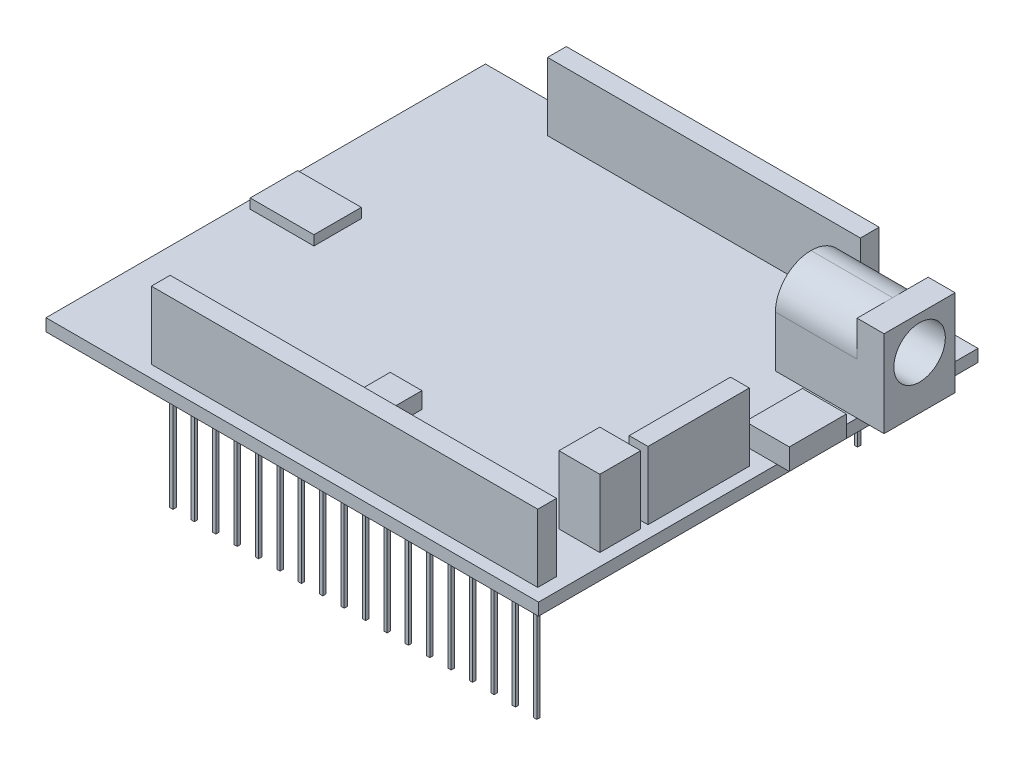
from build123d import *

# Parameters (mm, degrees)
SKETCH1_W            = 60.3
SKETCH1_H            = 53.8
BOSS_EXTRUDE1_DEPTH  = 1.5
SKETCH2_W            = 38.3
SKETCH2_H            = 2.3
SKETCH2_W_2          = 47.3
BOSS_EXTRUDE2_DEPTH  = 8.3
SKETCH3_W            = 5
SKETCH3_H            = 5
BOSS_EXTRUDE3_DEPTH  = 8.3
SKETCH4_W            = 2.3
SKETCH4_H            = 12.4
BOSS_EXTRUDE4_DEPTH  = 8.3
SKETCH5_W            = 5.4
SKETCH5_H            = 7
BOSS_EXTRUDE5_DEPTH  = 2.6
SKETCH6_W            = 7.8
SKETCH6_H            = 5.8
BOSS_EXTRUDE6_DEPTH  = 1.2
SKETCH7_W            = 10
SKETCH7_H            = 8.7
BOSS_EXTRUDE7_DEPTH  = 10.6
FILLET1_R            = 4.35
SKETCH9_W            = 3.3
SKETCH9_H            = 8.7
BOSS_EXTRUDE8_DEPTH  = 10.6
SKETCH10_R           = 3.15
CUT_EXTRUDE1_DEPTH   = 10.6
SKETCH11_W           = 0.4
SKETCH11_H           = 0.4
BOSS_EXTRUDE9_DEPTH  = 23.3
SKETCH12_W           = 0.4
SKETCH12_H           = 0.4
BOSS_EXTRUDE10_DEPTH = 23.3
SKETCH13_W           = 3.88
SKETCH13_H           = 5.16
BOSS_EXTRUDE11_DEPTH = 2


with BuildPart() as part:
    # Sketch1 → Boss-Extrude1 (new body)
    with BuildSketch(Plane(origin=(0, 0, 0), x_dir=(1, 0, 0), z_dir=(0, 1, 0))):
        Rectangle(SKETCH1_W, SKETCH1_H)
    extrude(amount=BOSS_EXTRUDE1_DEPTH)

    # Sketch2 → Boss-Extrude2 (add)
    with BuildSketch(Plane(origin=(0, 1.5, 0), x_dir=(1, 0, 0), z_dir=(0, 1, 0))):
        with Locations((0.4, 24.25)):
            Rectangle(SKETCH2_W, SKETCH2_H)
        with Locations((4.9, -24.25)):
            Rectangle(SKETCH2_W_2, SKETCH2_H)
    extrude(amount=BOSS_EXTRUDE2_DEPTH)

    # Sketch3 → Boss-Extrude3 (add)
    with BuildSketch(Plane(origin=(0, 1.5, 0), x_dir=(1, 0, 0), z_dir=(0, 1, 0))):
        with Locations((26.15, -15.4)):
            Rectangle(SKETCH3_W, SKETCH3_H)
    extrude(amount=BOSS_EXTRUDE3_DEPTH)

    # Sketch4 → Boss-Extrude4 (add)
    with BuildSketch(Plane(origin=(0, 1.5, 0), x_dir=(1, 0, 0), z_dir=(0, 1, 0))):
        with Locations((27.5, -5.8)):
            Rectangle(SKETCH4_W, SKETCH4_H)
    extrude(amount=BOSS_EXTRUDE4_DEPTH)

    # Sketch5 → Boss-Extrude5 (add)
    with BuildSketch(Plane(origin=(0, 1.5, 0), x_dir=(1, 0, 0), z_dir=(0, 1, 0))):
        with Locations((28.95, 5.8)):
            Rectangle(SKETCH5_W, SKETCH5_H)
    extrude(amount=BOSS_EXTRUDE5_DEPTH)

    # Sketch6 → Boss-Extrude6 (add)
    with BuildSketch(Plane(origin=(0, 1.5, 0), x_dir=(1, 0, 0), z_dir=(0, 1, 0))):
        with Locations((-25.25, 0)):
            Rectangle(SKETCH6_W, SKETCH6_H)
    extrude(amount=BOSS_EXTRUDE6_DEPTH)

    # Sketch7 → Boss-Extrude7 (add)
    with BuildSketch(Plane(origin=(0, 1.5, 0), x_dir=(1, 0, 0), z_dir=(0, 1, 0))):
        with Locations((25.15, 16.45)):
            Rectangle(SKETCH7_W, SKETCH7_H)
    extrude(amount=BOSS_EXTRUDE7_DEPTH)

    # Fillet1
    fillet1_edges = [part.edges().sort_by_distance(p)[0] for p in [
        (25.15, 12.1, -20.8),
        (25.15, 12.1, -12.1),
    ]]
    fillet(fillet1_edges, radius=FILLET1_R - 0.0001)  # a hair under: the kernel refuses the full size

    # Sketch9 → Boss-Extrude8 (add)
    with BuildSketch(Plane(origin=(0, 1.5, 0), x_dir=(1, 0, 0), z_dir=(0, 1, 0))):
        with Locations((31.8, 16.45)):
            Rectangle(SKETCH9_W, SKETCH9_H)
    extrude(amount=BOSS_EXTRUDE8_DEPTH)

    # Sketch10 → Cut-Extrude1 (cut)
    with BuildSketch(Plane(origin=(33.45, 0, 0), x_dir=(0, 0, -1), z_dir=(1, 0, 0))):
        with Locations((16.45, 7.95)):
            Circle(SKETCH10_R)
    extrude(amount=-CUT_EXTRUDE1_DEPTH, mode=Mode.SUBTRACT)

    # Sketch11 → Boss-Extrude9 (add)
    with BuildSketch(Plane(origin=(0, 9.8, 0), x_dir=(1, 0, 0), z_dir=(0, 1, 0))):
        with Locations((-17.25, 24.25)):
            Rectangle(SKETCH11_W, SKETCH11_H)
        with Locations((-14.53462, 24.25)):
            Rectangle(SKETCH11_W, SKETCH11_H)
        with Locations((-11.81924, 24.25)):
            Rectangle(SKETCH11_W, SKETCH11_H)
        with Locations((-9.10386, 24.25)):
            Rectangle(SKETCH11_W, SKETCH11_H)
        with Locations((-6.38848, 24.25)):
            Rectangle(SKETCH11_W, SKETCH11_H)
        with Locations((-3.6731, 24.25)):
            Rectangle(SKETCH11_W, SKETCH11_H)
        with Locations((-0.95772, 24.25)):
            Rectangle(SKETCH11_W, SKETCH11_H)
        with Locations((1.75766, 24.25)):
            Rectangle(SKETCH11_W, SKETCH11_H)
        with Locations((4.47304, 24.25)):
            Rectangle(SKETCH11_W, SKETCH11_H)
        with Locations((7.18842, 24.25)):
            Rectangle(SKETCH11_W, SKETCH11_H)
        with Locations((9.9038, 24.25)):
            Rectangle(SKETCH11_W, SKETCH11_H)
        with Locations((12.61918, 24.25)):
            Rectangle(SKETCH11_W, SKETCH11_H)
        with Locations((15.33456, 24.25)):
            Rectangle(SKETCH11_W, SKETCH11_H)
        with Locations((18.04994, 24.25)):
            Rectangle(SKETCH11_W, SKETCH11_H)
    extrude(amount=-BOSS_EXTRUDE9_DEPTH)

    # Sketch12 → Boss-Extrude10 (add)
    with BuildSketch(Plane(origin=(0, 9.8, 0), x_dir=(1, 0, 0), z_dir=(0, 1, 0))):
        with Locations((-17.25, -24.25)):
            Rectangle(SKETCH12_W, SKETCH12_H)
        with Locations((-14.63, -24.25)):
            Rectangle(SKETCH12_W, SKETCH12_H)
        with Locations((-12.01, -24.25)):
            Rectangle(SKETCH12_W, SKETCH12_H)
        with Locations((-9.39, -24.25)):
            Rectangle(SKETCH12_W, SKETCH12_H)
        with Locations((-6.77, -24.25)):
            Rectangle(SKETCH12_W, SKETCH12_H)
        with Locations((-4.15, -24.25)):
            Rectangle(SKETCH12_W, SKETCH12_H)
        with Locations((-1.53, -24.25)):
            Rectangle(SKETCH12_W, SKETCH12_H)
        with Locations((1.09, -24.25)):
            Rectangle(SKETCH12_W, SKETCH12_H)
        with Locations((3.71, -24.25)):
            Rectangle(SKETCH12_W, SKETCH12_H)
        with Locations((6.33, -24.25)):
            Rectangle(SKETCH12_W, SKETCH12_H)
        with Locations((8.95, -24.25)):
            Rectangle(SKETCH12_W, SKETCH12_H)
        with Locations((11.57, -24.25)):
            Rectangle(SKETCH12_W, SKETCH12_H)
        with Locations((14.19, -24.25)):
            Rectangle(SKETCH12_W, SKETCH12_H)
        with Locations((16.81, -24.25)):
            Rectangle(SKETCH12_W, SKETCH12_H)
        with Locations((19.43, -24.25)):
            Rectangle(SKETCH12_W, SKETCH12_H)
        with Locations((22.05, -24.25)):
            Rectangle(SKETCH12_W, SKETCH12_H)
        with Locations((24.67, -24.25)):
            Rectangle(SKETCH12_W, SKETCH12_H)
        with Locations((27.29, -24.25)):
            Rectangle(SKETCH12_W, SKETCH12_H)
    extrude(amount=-BOSS_EXTRUDE10_DEPTH)

    # Sketch13 → Boss-Extrude11 (add)
    with BuildSketch(Plane(origin=(0, 1.5, 0), x_dir=(1, 0, 0), z_dir=(0, 1, 0))):
        with Locations((0.65, -16.2)):
            Rectangle(SKETCH13_W, SKETCH13_H)
    extrude(amount=BOSS_EXTRUDE11_DEPTH)


solid = part.part
